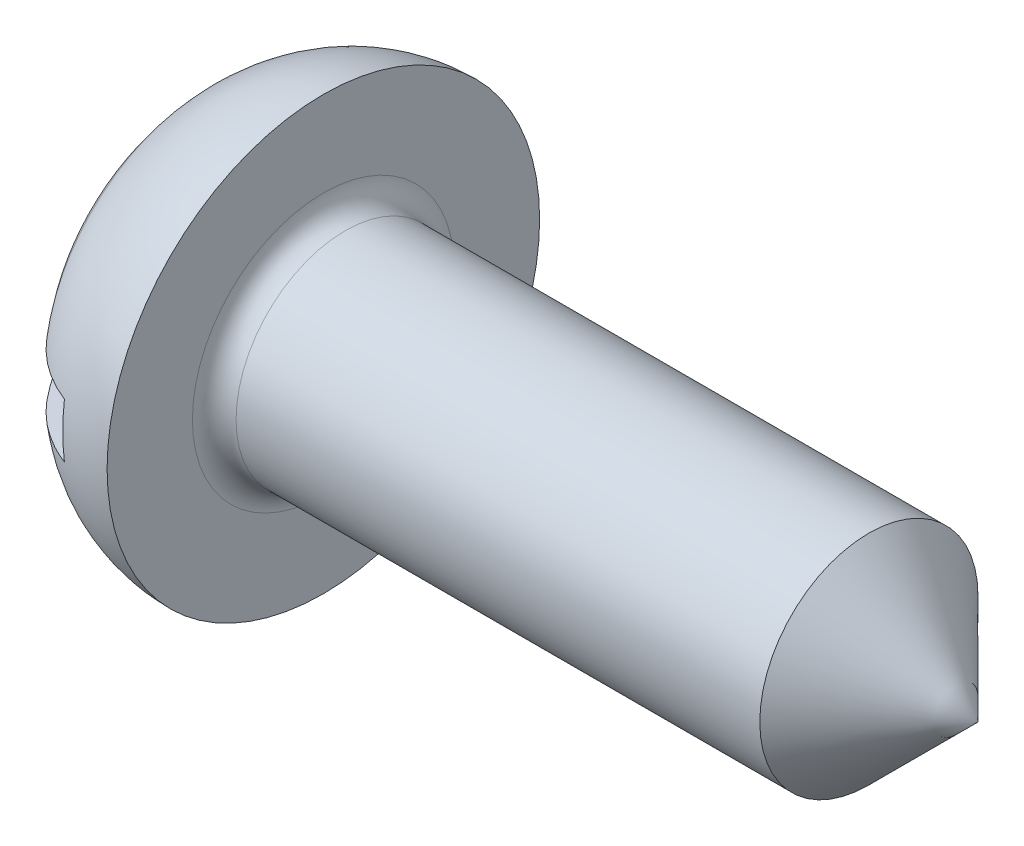
from build123d import *

# Parameters (mm, degrees)
SKETCH1_R       = 1
BASEBODY_DEPTH  = 6
SLOT_DEPTH      = 8.418156806
SLOT_DEPTH_BACK = 8.418156806
SKETCH3_W       = 0.5
SKETCH3_H       = 1.1
FILLET1_R       = 0.2


with BuildPart() as part:
    # Sketch2 → BaseHead (revolve)
    with BuildSketch(Plane(origin=(2.389236313, 0, -0.407091526), x_dir=(0, 0, -1), z_dir=(0, 1, 0))):
        with BuildLine():
            Line((-0.407091526, 0.789236313), (-0.407091526, 1.289236313))
            Line((-0.407091526, 1.289236313), (-0.157091526, 1.289236313))
            Line((-0.157091526, 1.289236313), (-0.157091526, 2.389236313))
            ThreePointArc((-0.157091526, 2.389236313), (0.501611668, 2.215742838), (1.08061182, 1.856927138))
            ThreePointArc((1.08061182, 1.856927138), (1.445443356, 1.377546613), (1.575053262, 0.789236313))
            Line((1.575053262, 0.789236313), (-0.407091526, 0.789236313))
        make_face()
    revolve(axis=Axis((3.397247135, 0, 0), (-1, 0, 0)))

    # Sketch1 → BaseBody (add)
    with BuildSketch(Plane(origin=(1.6, 0.592295435, -0.173354592), x_dir=(0, 0, -1), z_dir=(1, 0, 0))):
        with Locations((-0.173354592, -0.592295435)):
            Circle(SKETCH1_R)
    extrude(amount=BASEBODY_DEPTH)

    # Sketch3 → Slot (cut, two sides: drawn at the far end of the back side and taken through both)
    with BuildSketch(Plane(origin=(1.197809665, 1.197809665, 0), x_dir=(0, 1, 0), z_dir=(0, 0, 1)).offset(-SLOT_DEPTH_BACK)):
        with Locations((-1.197809665, 0.647809665)):
            Rectangle(SKETCH3_W, SKETCH3_H)
    extrude(amount=SLOT_DEPTH + SLOT_DEPTH_BACK, mode=Mode.SUBTRACT)

    # Sketch4 → Cut-Revolve1 (revolve, cut)
    with BuildSketch(Plane(origin=(23.263333075, -6.736666925, 0), x_dir=(0, 1, 0), z_dir=(0, 0, 1))):
        Polygon((8.736666925, 14.663333075), (8.736666925, 17.663333075), (6.736666925, 15.663333075), (6.736666925, 14.663333075), align=None)
    revolve(axis=Axis((5.634860225, 0, 0), (1, 0, 0)), mode=Mode.SUBTRACT)

    # Fillet1
    fillet1_edges = [part.edges().sort_by_distance(p)[0] for p in [
        (1.6, 0, 1),
    ]]
    fillet(fillet1_edges, radius=FILLET1_R)


solid = part.part
